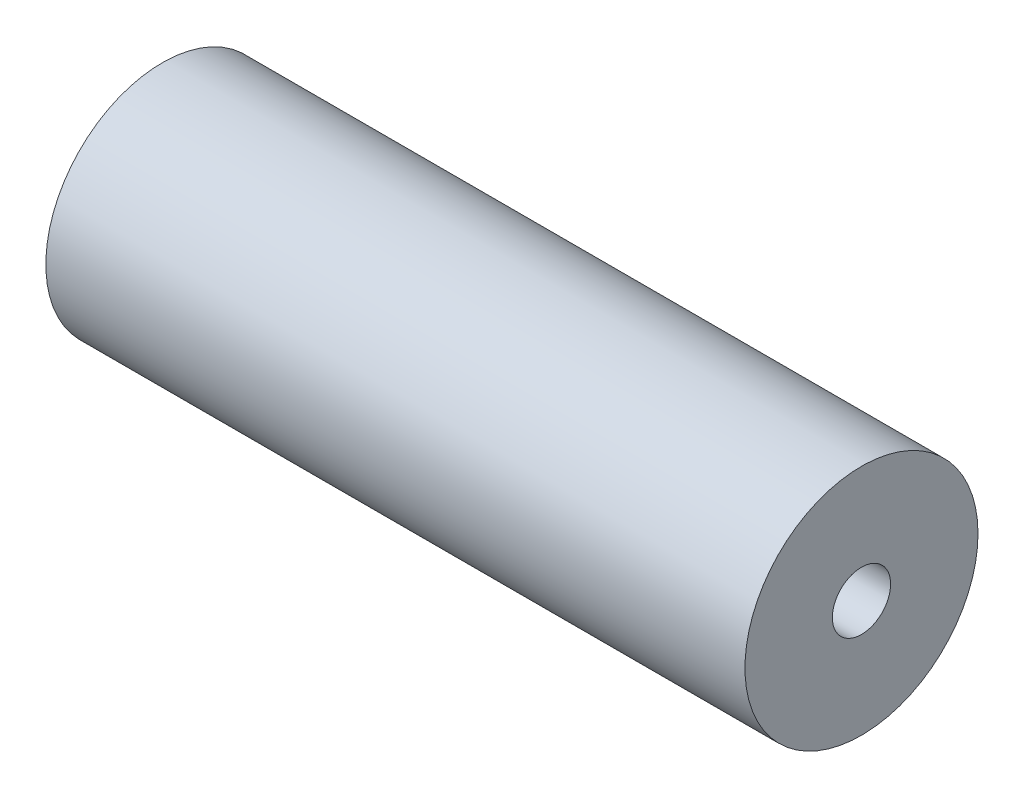
from build123d import *

# Parameters (mm, degrees)
ESQUISSE1_R             = 10
BOSS_EXTRU_1_DEPTH      = 60
ESQUISSE2_R             = 2.5
ENL_V_MAT_EXTRU_1_DEPTH = 60


with BuildPart() as part:
    # Esquisse1 → Boss.-Extru.1 (new body)
    with BuildSketch(Plane(origin=(0, 0, 0), x_dir=(0, 0, -1), z_dir=(1, 0, 0))):
        Circle(ESQUISSE1_R)
    extrude(amount=BOSS_EXTRU_1_DEPTH)

    # Esquisse2 → Enlèv. mat.-Extru.1 (cut)
    with BuildSketch(Plane.ZY):
        Circle(ESQUISSE2_R)
    extrude(amount=-ENL_V_MAT_EXTRU_1_DEPTH, mode=Mode.SUBTRACT)


solid = part.part
